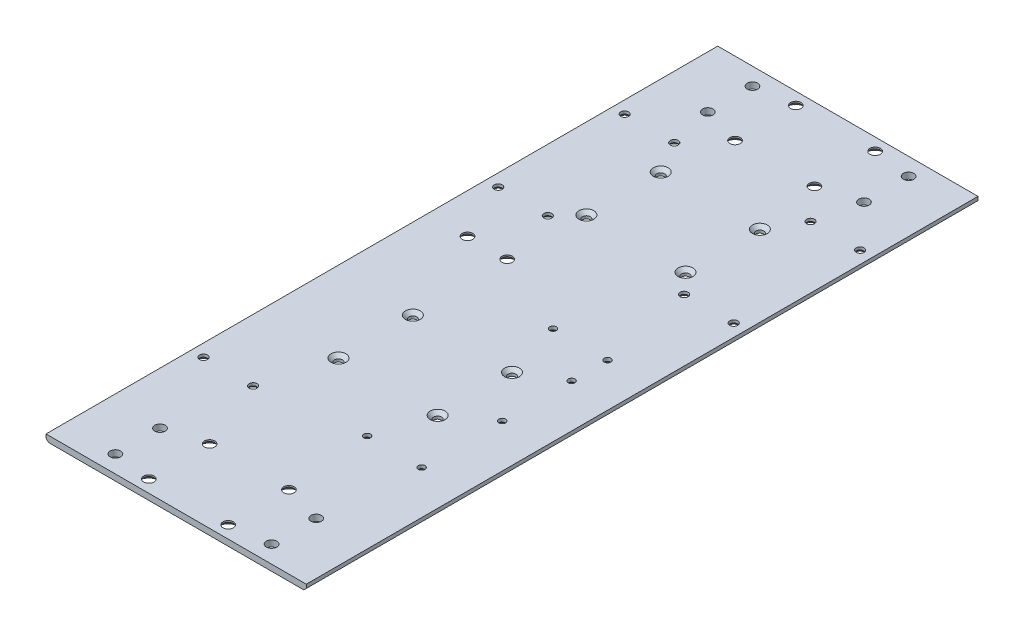
from build123d import *

# Parameters (mm, degrees)
SKETCH_1_W          = 105
SKETCH_1_H          = 271
SKETCH_1_R          = 2.1
EXTRUDE_1_DEPTH     = 2.5
SKETCH_2_R          = 1.6
SKETCH_2_R_2        = 2.1
SKETCH_2_R_3        = 1.35
CUT_EXTRUDE_1_DEPTH = 10
CHAMFER_1_SIZE      = 1.9
CHAMFER_2_SIZE      = 1.4
CHAMFER_3_SIZE      = 1.15
CHAMFER_4_SIZE      = 1.4
CHAMFER_5_SIZE      = 1


with BuildPart() as part:
    # 草图1 → 凸台-拉伸1 (new body)
    with BuildSketch(Plane(origin=(0, 0, 0), x_dir=(1, 0, 0), z_dir=(0, 1, 0))):
        Rectangle(SKETCH_1_W, SKETCH_1_H)
        with Locations((16, -130.5)):
            Circle(SKETCH_1_R, mode=Mode.SUBTRACT)
        with Locations((-16, -130.5)):
            Circle(SKETCH_1_R, mode=Mode.SUBTRACT)
        with Locations((16, 130.5)):
            Circle(SKETCH_1_R, mode=Mode.SUBTRACT)
        with Locations((-16, 130.5)):
            Circle(SKETCH_1_R, mode=Mode.SUBTRACT)
    extrude(amount=EXTRUDE_1_DEPTH)

    # 草图2 → 切除-拉伸1 (cut)
    with BuildSketch(Plane(origin=(0, 2.5, 0), x_dir=(1, 0, 0), z_dir=(0, 1, 0))):
        with Locations((47.5, 41.95)):
            Circle(SKETCH_2_R)
        with Locations((27.5, 41.95)):
            Circle(SKETCH_2_R)
        with Locations((47.5, 92.95)):
            Circle(SKETCH_2_R)
        with Locations((27.5, 92.95)):
            Circle(SKETCH_2_R)
        with Locations((-27.5, 41.95)):
            Circle(SKETCH_2_R)
        with Locations((-47.5, 41.95)):
            Circle(SKETCH_2_R)
        with Locations((-47.5, 92.95)):
            Circle(SKETCH_2_R)
        with Locations((-27.5, 92.95)):
            Circle(SKETCH_2_R)
        with Locations((-27.5, -76.95)):
            Circle(SKETCH_2_R)
        with Locations((-47.5, -76.95)):
            Circle(SKETCH_2_R)
        with Locations((-36.5, 18.55)):
            Circle(SKETCH_2_R_2)
        with Locations((-20.5, 18.55)):
            Circle(SKETCH_2_R_2)
        with Locations((35, 3.549999997)):
            Circle(SKETCH_2_R_3)
        with Locations((13.000000181, 3.549999997)):
            Circle(SKETCH_2_R_3)
        with Locations((35, -10.950003407)):
            Circle(SKETCH_2_R_3)
        with Locations((35, -38.950003407)):
            Circle(SKETCH_2_R_3)
        with Locations((35, -71.45)):
            Circle(SKETCH_2_R_3)
        with Locations((13.000000181, -71.45)):
            Circle(SKETCH_2_R_3)
        with Locations((-16, 106)):
            Circle(SKETCH_2_R_2)
        with Locations((16, 106)):
            Circle(SKETCH_2_R_2)
        with Locations((-16, -106)):
            Circle(SKETCH_2_R_2)
        with Locations((16, -106)):
            Circle(SKETCH_2_R_2)
        with Locations((31.5, -110.5)):
            Circle(SKETCH_2_R_2)
        with Locations((31.5, -128.5)):
            Circle(SKETCH_2_R_2)
        with Locations((-31.5, -128.5)):
            Circle(SKETCH_2_R_2)
        with Locations((-31.5, -110.5)):
            Circle(SKETCH_2_R_2)
        with Locations((-31.5, 110.5)):
            Circle(SKETCH_2_R_2)
        with Locations((-31.5, 128.5)):
            Circle(SKETCH_2_R_2)
        with Locations((31.5, 128.5)):
            Circle(SKETCH_2_R_2)
        with Locations((31.5, 110.5)):
            Circle(SKETCH_2_R_2)
        with Locations((20, -20)):
            Circle(SKETCH_2_R)
        with Locations((-20, -20)):
            Circle(SKETCH_2_R)
        with Locations((20, -50)):
            Circle(SKETCH_2_R)
        with Locations((-20, -50)):
            Circle(SKETCH_2_R)
        with Locations((-20, 50)):
            Circle(SKETCH_2_R)
        with Locations((20, 50)):
            Circle(SKETCH_2_R)
        with Locations((-20, 80)):
            Circle(SKETCH_2_R)
        with Locations((20, 80)):
            Circle(SKETCH_2_R)
    extrude(amount=-CUT_EXTRUDE_1_DEPTH, mode=Mode.SUBTRACT)

    # 倒角1
    chamfer_1_edges = [part.edges().sort_by_distance(p)[0] for p in [
        (-18.1, 0, 106),
        (-18.1, 0, 130.5),
        (13.9, 0, 130.5),
        (13.9, 0, 106),
        (13.9, 0, -106),
        (-18.1, 0, -106),
        (-18.1, 0, -130.5),
        (13.9, 0, -130.5),
        (-22.6, 0, -18.55),
        (-38.6, 0, -18.55),
    ]]
    chamfer(chamfer_1_edges, length=CHAMFER_1_SIZE)

    # 倒角2
    chamfer_2_edges = [part.edges().sort_by_distance(p)[0] for p in [
        (-49.1, 0, 76.95),
        (-29.1, 0, 76.95),
        (25.9, 0, -41.95),
        (45.9, 0, -41.95),
        (45.9, 0, -92.95),
        (25.9, 0, -92.95),
        (-49.1, 0, -92.95),
        (-29.1, 0, -92.95),
        (-49.1, 0, -41.95),
        (-29.1, 0, -41.95),
    ]]
    chamfer(chamfer_2_edges, length=CHAMFER_2_SIZE)

    # 倒角3
    chamfer_3_edges = [part.edges().sort_by_distance(p)[0] for p in [
        (11.650000181, 0, -3.549999997),
        (33.65, 0, -3.549999997),
        (33.65, 0, 10.950003407),
        (33.65, 0, 38.950003407),
        (33.65, 0, 71.45),
        (11.650000181, 0, 71.45),
    ]]
    chamfer(chamfer_3_edges, length=CHAMFER_3_SIZE)

    # 倒角4
    chamfer_4_edges = [part.edges().sort_by_distance(p)[0] for p in [
        (-21.6, 2.5, 50),
        (-21.6, 2.5, 20),
        (18.4, 2.5, 50),
        (18.4, 2.5, 20),
        (-21.6, 2.5, -50),
        (-21.6, 2.5, -80),
        (18.4, 2.5, -50),
        (18.4, 2.5, -80),
    ]]
    chamfer(chamfer_4_edges, length=CHAMFER_4_SIZE)

    # 倒角5
    chamfer_5_edges = [part.edges().sort_by_distance(p)[0] for p in [
        (52.5, 0, 0),
        (-52.5, 0, 0),
    ]]
    chamfer(chamfer_5_edges, length=CHAMFER_5_SIZE)


solid = part.part
